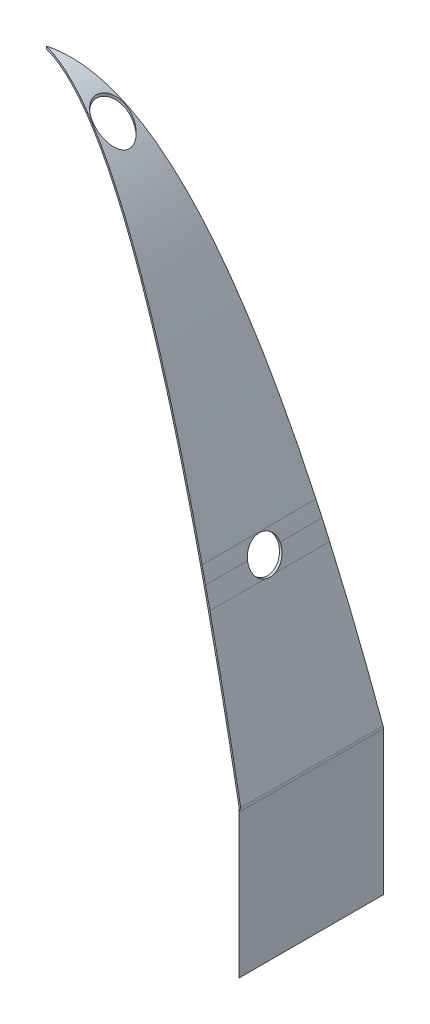
from build123d import *

# Parameters (mm, degrees)
Z_KLADN_START                 = -40
Z_KLADN_PLECH1_DEPTH          = 80
SKICA6_R                      = 5
ODEBRAT_VYSUNUT_M5_DEPTH      = 80
SKICA7_R                      = 5
ODEBRAT_VYSUNUT_M6_DEPTH      = 136.152732874
ODEBRAT_VYSUNUT_M7_DEPTH      = 136.152732874
ODEBRAT_VYSUNUT_M7_DEPTH_BACK = 136.152732874


# Read off the part's stored shape, not the designer's step: Základní plech1
with BuildPart() as part:
    # Základní plech1 outline → Základní plech1 (new body)
    with BuildSketch(Plane.XY.offset(Z_KLADN_START)):
        with BuildLine():
            ThreePointArc((66.046506475, 0.814291847), (65.315681779, 3.025766211), (64.577281534, 5.23472268))
            add(Edge.make_bspline(
                [(64.577281534, 5.23472268), (59.248115641, 21.085633376), (53.917222464, 34.96092249), (43.245715173, 58.766680151), (37.905782976, 68.697174226), (27.195827879, 84.624858332), (21.826905506, 90.625104065), (13.700502713, 96.667836058), (10.978385721, 98.188516347), (5.504780137, 100.223582318), (2.752916928, 100.7366), (0, 100.7366)],
                knots=[0, 0, 0, 0, 0.25, 0.25, 0.5, 0.5, 0.75, 0.75, 0.875, 0.875, 1, 1, 1, 1], degree=3))
            Line((0, 100.7366), (-3e-09, 100))
            add(Edge.make_bspline(
                [(63.87908038, 5.000000058), (31.939540189, 100.000000005), (-3e-09, 100)],
                knots=[0.495126603, 0.495126603, 0.495126603, 0.5, 0.5, 0.5], degree=2))
            ThreePointArc((63.87908038, 5.000000058), (64.616680213, 2.793438057), (65.346712709, 0.584360889))
            ThreePointArc((65.346712709, 0.584360889), (66.257415286, -2.206022867), (67.157033244, -5))
            add(Edge.make_bspline(
                [(79.931495191, -48.744928843), (73.544264217, -24.972867169), (67.157033244, -5)],
                knots=[0.493901948, 0.493901948, 0.493901948, 0.494876525, 0.494876525, 0.494876525], degree=2))
            ThreePointArc((79.931495191, -48.744928843), (79.982799836, -49.002161205), (80, -49.263895439))
            Line((80, -49.263895439), (80, -92.944799161))
            Line((80, -92.944799161), (80.7366, -92.944799161))
            Line((80.7366, -92.944799161), (80.7366, -49.263895439))
            ThreePointArc((80.7366, -49.263895439), (80.713065016, -48.905764487), (80.64286487, -48.553793446))
            add(Edge.make_bspline(
                [(80.64286487, -48.553793446), (76.382159258, -32.69625565), (72.120911891, -18.103783515), (67.858630527, -4.775632418)],
                knots=[0, 0, 0, 0, 1, 1, 1, 1], degree=3))
            ThreePointArc((67.858630527, -4.775632418), (66.958116332, -1.978871807), (66.046506475, 0.814291847))
        make_face()
    extrude(amount=Z_KLADN_PLECH1_DEPTH)

    # Skica6 → Odebrat vysunutím5 (cut)
    with BuildSketch(Plane(origin=(0, 0, 0), x_dir=(0, 0, -1), z_dir=(1, 0, 0))):
        with Locations(Location((0, 0, 0), (0, 0, 173.28837879))):
            Circle(SKICA6_R)
    extrude(amount=ODEBRAT_VYSUNUT_M5_DEPTH, mode=Mode.SUBTRACT)

    # Skica7 → Odebrat vysunutím6 (cut, through all)
    with BuildSketch(Plane(origin=(0, 0, 0), x_dir=(1, 0, 0), z_dir=(0, 1, 0))):
        with Locations(Location((20.207259422, 0, 0), (0, 0, 90))):
            Circle(SKICA7_R)
    extrude(amount=ODEBRAT_VYSUNUT_M6_DEPTH, mode=Mode.SUBTRACT)

    # Skica8 → Odebrat vysunutím7 (cut, two sides: drawn at the far end of the back side and taken through both)
    with BuildSketch(Plane(origin=(0, 0, 0), x_dir=(1, 0, 0), z_dir=(0, 1, 0)).offset(-ODEBRAT_VYSUNUT_M7_DEPTH_BACK)):
        Polygon((51.674932002, -116.024299542), (95.083571171, -111.492359478), (80.64286487, -21.608190517), (0, 0), (0, -116.024299542), align=None)
        Polygon((100.071039545, 40), (80.64286487, 21.608190517), (0, 0), (-3e-09, 40), (80.000000002, 40), align=None)
    extrude(amount=ODEBRAT_VYSUNUT_M7_DEPTH + ODEBRAT_VYSUNUT_M7_DEPTH_BACK, mode=Mode.SUBTRACT)


solid = part.part
